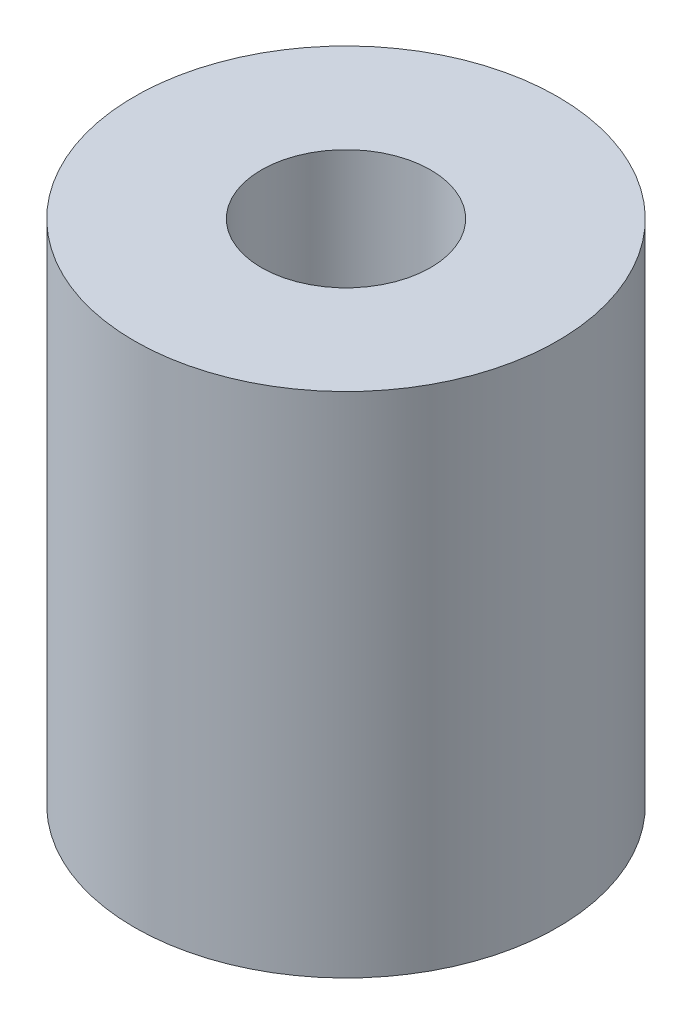
from build123d import *

# Parameters (mm, degrees)
SKETCH1_R           = 5
BOSS_EXTRUDE1_DEPTH = 12
CUT_EXTRUDE1_REACH  = 15.928
SKETCH2_R           = 2


with BuildPart() as part:
    # Sketch1 → Boss-Extrude1 (new body)
    with BuildSketch(Plane(origin=(0, 0, 0), x_dir=(1, 0, 0), z_dir=(0, 1, 0))):
        Circle(SKETCH1_R)
    extrude(amount=BOSS_EXTRUDE1_DEPTH)

    # Sketch2 → Cut-Extrude1 (cut, up to next)
    with BuildSketch(Plane(origin=(0, 12, 0), x_dir=(1, 0, 0), z_dir=(0, 1, 0)), mode=Mode.PRIVATE) as cut_extrude1_sk1:
        Circle(SKETCH2_R)
    cut_extrude1_tool1 = extrude(cut_extrude1_sk1.sketch, amount=-CUT_EXTRUDE1_REACH, mode=Mode.PRIVATE) & part.part
    add(cut_extrude1_tool1.solids().sort_by_distance((0, 12, 0))[0], mode=Mode.SUBTRACT)


solid = part.part
